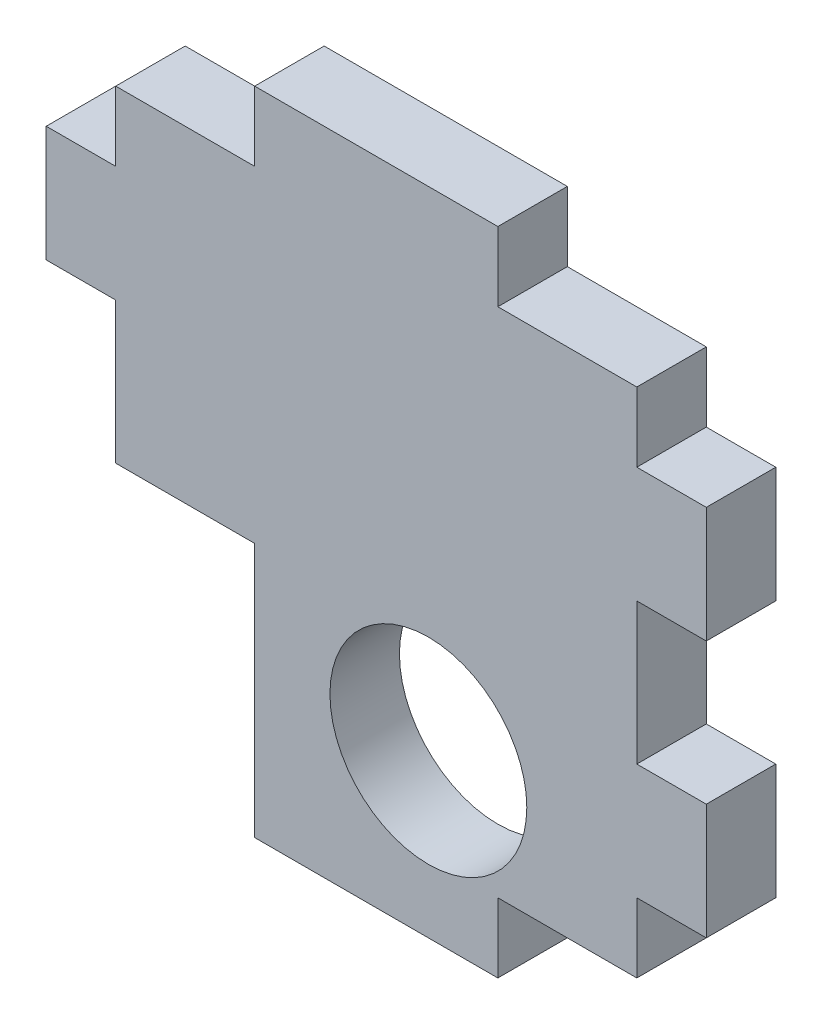
from build123d import *

# Parameters (mm, degrees)
BASE_DEPTH            = 3
ESBO_O1_R             = 4.25
PASSAGEMLEDELDR_DEPTH = 3


with BuildPart() as part:
    # BaseEsboco → Base (new body)
    with BuildSketch(Plane.XY):
        Polygon((0, 0), (6, 0), (6, -3), (16.5, -3), (16.5, 0), (22.5, 0), (22.5, 3), (25.5, 3), (25.5, 8), (22.5, 8), (22.5, 14.1), (25.5, 14.1), (25.5, 19.1), (22.5, 19.1), (22.5, 22.1), (16.5, 22.1), (16.5, 25.1), (6, 25.1), (6, 22.1), (0, 22.1), (0, 19.1), (-3, 19.1), (-3, 14.1), (0, 14.1), (0, 8), (-3, 8), (-3, 3), (0, 3), align=None)
    extrude(amount=BASE_DEPTH)

    # Esboço1 → PassagemLEDeLDR (cut)
    with BuildSketch(Plane.XY.offset(3)):
        with Locations((13.5, 4)):
            Circle(ESBO_O1_R)
        Polygon((0, 8), (6, 8), (6, 0), (0, 0), (0, 3), (-3, 3), (-3, 8), align=None)
    extrude(amount=-PASSAGEMLEDELDR_DEPTH, mode=Mode.SUBTRACT)


solid = part.part
